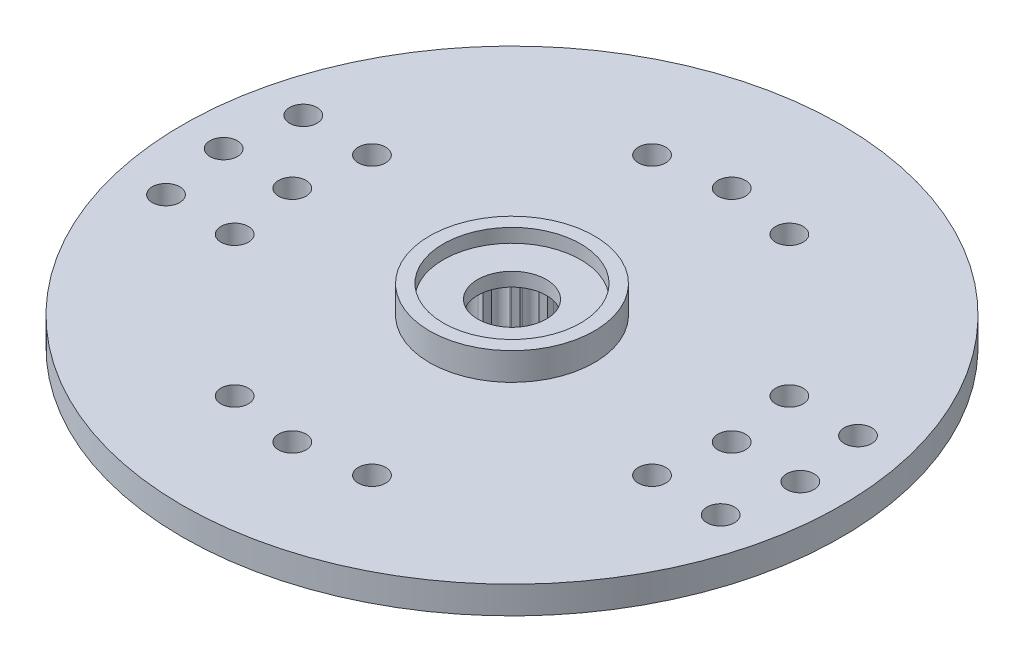
from build123d import *

# Parameters (mm, degrees)
SKETCH1_R           = 5
BOSS_EXTRUDE1_DEPTH = 2
SKETCH2_R           = 12
BOSS_EXTRUDE2_DEPTH = 2
SKETCH3_R           = 1.25
CUT_EXTRUDE1_DEPTH  = 18.435595774
CUT_EXTRUDE2_DEPTH  = 3
CUT_EXTRUDE3_START  = -1
SKETCH5_R           = 12
SKETCH5_R_2         = 3
CUT_EXTRUDE3_DEPTH  = 1
SKETCH6_R           = 2.5
CUT_EXTRUDE4_DEPTH  = 0.5
SKETCH7_R           = 0.5
CUT_EXTRUDE5_DEPTH  = 18.088007491


with BuildPart() as part:
    # Sketch1 → Boss-Extrude1 (new body)
    with BuildSketch(Plane(origin=(0, 0, 0), x_dir=(1, 0, 0), z_dir=(0, 1, 0))):
        Circle(SKETCH1_R)
    extrude(amount=BOSS_EXTRUDE1_DEPTH)

    # Sketch2 → Boss-Extrude2 (add)
    with BuildSketch(Plane(origin=(0, 2, 0), x_dir=(1, 0, 0), z_dir=(0, 1, 0))):
        Circle(SKETCH2_R)
    extrude(amount=BOSS_EXTRUDE2_DEPTH)

    # Sketch3 → Cut-Extrude1 (cut, through all)
    with BuildSketch(Plane.XZ):
        Circle(SKETCH3_R)
    extrude(amount=-CUT_EXTRUDE1_DEPTH, mode=Mode.SUBTRACT)

    # Sketch4 → Cut-Extrude2 (cut)
    with BuildSketch(Plane.XZ):
        with BuildLine():
            Line((0.25, 2.25), (0.25, 1.984313483))
            ThreePointArc((0.25, 1.984313483), (0.367499036, 1.965946199), (0.483698652, 1.940627634))
            Line((0.483698652, 1.940627634), (0.579675692, 2.188372933))
            ThreePointArc((0.579675692, 2.188372933), (0.903104165, 2.331180574), (1.045911806, 2.0077521))
            Line((1.045911806, 2.0077521), (0.949934766, 1.760006801))
            ThreePointArc((0.949934766, 1.760006801), (1.052864326, 1.700434271), (1.15207112, 1.63484927))
            Line((1.15207112, 1.63484927), (1.331062969, 1.831193975))
            ThreePointArc((1.331062969, 1.831193975), (1.684239109, 1.847522293), (1.700567428, 1.494346153))
            Line((1.700567428, 1.494346153), (1.521575579, 1.298001448))
            ThreePointArc((1.521575579, 1.298001448), (1.596034455, 1.205269273), (1.66485, 1.108275452))
            Line((1.66485, 1.108275452), (1.902682817, 1.226702123))
            ThreePointArc((1.902682817, 1.226702123), (2.237908228, 1.114345889), (2.125551994, 0.779120478))
            Line((2.125551994, 0.779120478), (1.887719178, 0.660693807))
            ThreePointArc((1.887719178, 0.660693807), (1.923651286, 0.54732598), (1.952781662, 0.432022894))
            Line((1.952781662, 0.432022894), (2.217334807, 0.456537353))
            ThreePointArc((2.217334807, 0.456537353), (2.489335441, 0.230670899), (2.263468987, -0.041329735))
            Line((2.263468987, -0.041329735), (1.998915842, -0.065844194))
            ThreePointArc((1.998915842, -0.065844194), (1.991468353, -0.184536719), (1.97697934, -0.30257675))
            Line((1.97697934, -0.30257675), (2.232523445, -0.375285317))
            ThreePointArc((2.232523445, -0.375285317), (2.404564108, -0.684157475), (2.09569195, -0.856198138))
            Line((2.09569195, -0.856198138), (1.840147845, -0.783489572))
            ThreePointArc((1.840147845, -0.783489572), (1.790326583, -0.891476712), (1.734175003, -0.996311728))
            Line((1.734175003, -0.996311728), (1.94619742, -1.156423625))
            ThreePointArc((1.94619742, -1.156423625), (1.995043068, -1.506586591), (1.644880102, -1.555432239))
            Line((1.644880102, -1.555432239), (1.432857685, -1.395320341))
            ThreePointArc((1.432857685, -1.395320341), (1.347391287, -1.478017834), (1.257160723, -1.555489285))
            Line((1.257160723, -1.555489285), (1.39702665, -1.781380515))
            ThreePointArc((1.39702665, -1.781380515), (1.316080407, -2.125542839), (0.971918083, -2.044596596))
            Line((0.971918083, -2.044596596), (0.832052155, -1.818705367))
            ThreePointArc((0.832052155, -1.818705367), (0.722483332, -1.864944459), (0.610359921, -1.904589396))
            Line((0.610359921, -1.904589396), (0.65917969, -2.165752095))
            ThreePointArc((0.65917969, -2.165752095), (0.459373795, -2.457432749), (0.16769314, -2.257626854))
            Line((0.16769314, -2.257626854), (0.118873371, -1.996464155))
            ThreePointArc((0.118873371, -1.996464155), (0, -2), (-0.118873371, -1.996464155))
            Line((-0.118873371, -1.996464155), (-0.16769314, -2.257626854))
            ThreePointArc((-0.16769314, -2.257626854), (-0.459373795, -2.457432749), (-0.65917969, -2.165752095))
            Line((-0.65917969, -2.165752095), (-0.610359921, -1.904589396))
            ThreePointArc((-0.610359921, -1.904589396), (-0.722483332, -1.864944459), (-0.832052155, -1.818705367))
            Line((-0.832052155, -1.818705367), (-0.971918083, -2.044596596))
            ThreePointArc((-0.971918083, -2.044596596), (-1.316080407, -2.125542839), (-1.39702665, -1.781380515))
            Line((-1.39702665, -1.781380515), (-1.257160723, -1.555489285))
            ThreePointArc((-1.257160723, -1.555489285), (-1.347391287, -1.478017834), (-1.432857685, -1.395320341))
            Line((-1.432857685, -1.395320341), (-1.644880102, -1.555432239))
            ThreePointArc((-1.644880102, -1.555432239), (-1.995043068, -1.506586591), (-1.94619742, -1.156423625))
            Line((-1.94619742, -1.156423625), (-1.734175003, -0.996311728))
            ThreePointArc((-1.734175003, -0.996311728), (-1.790326583, -0.891476712), (-1.840147845, -0.783489572))
            Line((-1.840147845, -0.783489572), (-2.09569195, -0.856198138))
            ThreePointArc((-2.09569195, -0.856198138), (-2.404564108, -0.684157475), (-2.232523445, -0.375285317))
            Line((-2.232523445, -0.375285317), (-1.97697934, -0.30257675))
            ThreePointArc((-1.97697934, -0.30257675), (-1.991468353, -0.184536719), (-1.998915842, -0.065844194))
            Line((-1.998915842, -0.065844194), (-2.263468987, -0.041329735))
            ThreePointArc((-2.263468987, -0.041329735), (-2.489335441, 0.230670899), (-2.217334807, 0.456537353))
            Line((-2.217334807, 0.456537353), (-1.952781662, 0.432022894))
            ThreePointArc((-1.952781662, 0.432022894), (-1.923651286, 0.54732598), (-1.887719178, 0.660693807))
            Line((-1.887719178, 0.660693807), (-2.125551994, 0.779120478))
            ThreePointArc((-2.125551994, 0.779120478), (-2.237908228, 1.114345889), (-1.902682817, 1.226702123))
            Line((-1.902682817, 1.226702123), (-1.66485, 1.108275452))
            ThreePointArc((-1.66485, 1.108275452), (-1.596034455, 1.205269273), (-1.521575579, 1.298001448))
            Line((-1.521575579, 1.298001448), (-1.700567428, 1.494346153))
            ThreePointArc((-1.700567428, 1.494346153), (-1.684239109, 1.847522293), (-1.331062969, 1.831193975))
            Line((-1.331062969, 1.831193975), (-1.15207112, 1.63484927))
            ThreePointArc((-1.15207112, 1.63484927), (-1.052864326, 1.700434271), (-0.949934766, 1.760006801))
            Line((-0.949934766, 1.760006801), (-1.045911806, 2.0077521))
            ThreePointArc((-1.045911806, 2.0077521), (-0.903104165, 2.331180574), (-0.579675692, 2.188372933))
            Line((-0.579675692, 2.188372933), (-0.483698652, 1.940627634))
            ThreePointArc((-0.483698652, 1.940627634), (-0.367499036, 1.965946199), (-0.25, 1.984313483))
            Line((-0.25, 1.984313483), (-0.25, 2.25))
            ThreePointArc((-0.25, 2.25), (0, 2.5), (0.25, 2.25))
        make_face()
    extrude(amount=-CUT_EXTRUDE2_DEPTH, mode=Mode.SUBTRACT)

    # Sketch5 → Cut-Extrude3 (cut)
    with BuildSketch(Plane(origin=(0, 4, 0), x_dir=(1, 0, 0), z_dir=(0, 1, 0)).offset(CUT_EXTRUDE3_START)):
        Circle(SKETCH5_R)
        Circle(SKETCH5_R_2, mode=Mode.SUBTRACT)
    extrude(amount=CUT_EXTRUDE3_DEPTH, mode=Mode.SUBTRACT)

    # Sketch6 → Cut-Extrude4 (cut)
    with BuildSketch(Plane(origin=(0, 4, 0), x_dir=(1, 0, 0), z_dir=(0, 1, 0))):
        Circle(SKETCH6_R)
    extrude(amount=-CUT_EXTRUDE4_DEPTH, mode=Mode.SUBTRACT)

    # Sketch7 → Cut-Extrude5 (cut, through all)
    with BuildSketch(Plane.XZ.offset(-2)):
        with Locations((0, 8)):
            Circle(SKETCH7_R)
        with Locations((2.5, 7.599342077)):
            Circle(SKETCH7_R)
        with Locations((-2.5, 7.599342077)):
            Circle(SKETCH7_R)
        with Locations((8, 0)):
            Circle(SKETCH7_R)
        with Locations((7.599342077, -2.5)):
            Circle(SKETCH7_R)
        with Locations((7.599342077, 2.5)):
            Circle(SKETCH7_R)
        with Locations((0, -8)):
            Circle(SKETCH7_R)
        with Locations((-2.5, -7.599342077)):
            Circle(SKETCH7_R)
        with Locations((2.5, -7.599342077)):
            Circle(SKETCH7_R)
        with Locations((-8, 0)):
            Circle(SKETCH7_R)
        with Locations((-7.599342077, 2.5)):
            Circle(SKETCH7_R)
        with Locations((-7.599342077, -2.5)):
            Circle(SKETCH7_R)
        with Locations((10.099342077, 2.5)):
            Circle(SKETCH7_R)
        with Locations((10.099342077, -2.5)):
            Circle(SKETCH7_R)
        with Locations((10.5, 0)):
            Circle(SKETCH7_R)
        with Locations((-10.099342077, 2.5)):
            Circle(SKETCH7_R)
        with Locations((-10.099342077, -2.5)):
            Circle(SKETCH7_R)
        with Locations((-10.5, 0)):
            Circle(SKETCH7_R)
    extrude(amount=-CUT_EXTRUDE5_DEPTH, mode=Mode.SUBTRACT)


solid = part.part
